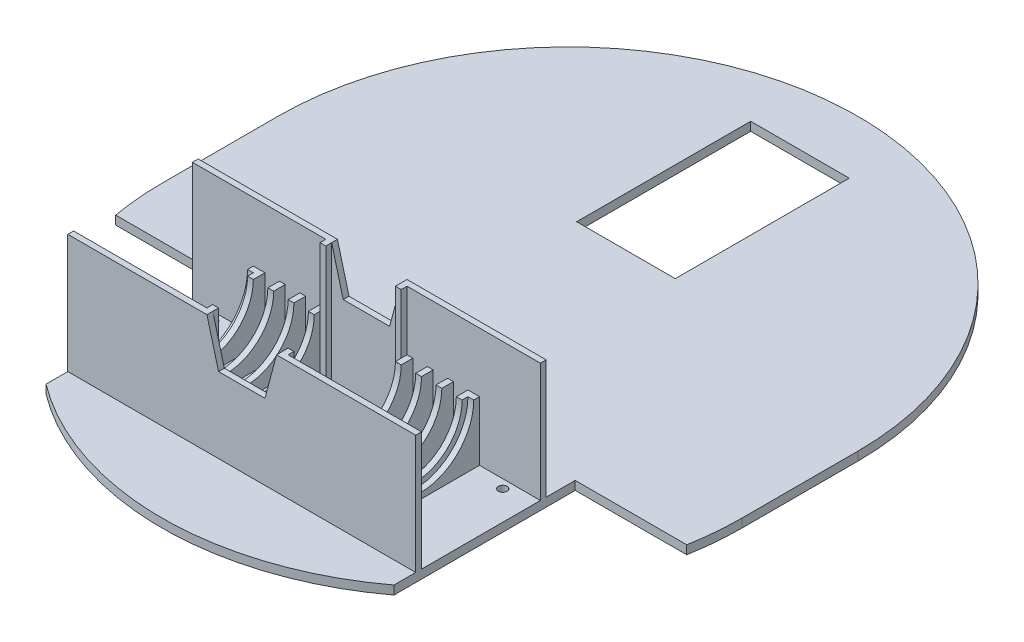
from build123d import *

# Parameters (mm, degrees)
EXTRUDE_1202_DEPTH     = 3
CUT_EXTRUDE_START      = -3
CUT_EXTRUDE_1565_DEPTH = 3
SKETCH_3_W             = 34
SKETCH_3_H             = 60
CUT_EXTRUDE_1805_DEPTH = 3
SKETCH_4_W             = 120
SKETCH_4_H             = 2
EXTRUDE_2279_DEPTH     = 41
SKETCH_5_W             = 4
SKETCH_5_H             = 41
SKETCH_5_W_2           = 2
EXTRUDE_3778_DEPTH     = 20.5
SKETCH_10_R            = 1.5
CUT_EXTRUDE_4209_DEPTH = 177.864354803
CUT_EXTRUDE_4433_DEPTH = 2
CUT_EXTRUDE_START_2    = -2
CUT_EXTRUDE_4648_DEPTH = 2
SKETCH_11_R            = 16.5
CUT_EXTRUDE_4763_DEPTH = 23
CUT_EXTRUDE_START_3    = -23
SKETCH_12_R            = 16.5
CUT_EXTRUDE_4892_DEPTH = 23
CUT_EXTRUDE_5120_DEPTH = 45
SKETCH_14_W            = 2
SKETCH_14_H            = 2
EXTRUDE_5971_DEPTH     = 41


with BuildPart() as part:
    # 草图1 → Extrude 1202 (new body)
    with BuildSketch(Plane(origin=(0, 0, 0), x_dir=(1, 0, 0), z_dir=(0, 1, 0))):
        with BuildLine():
            Line((-100, 40), (-100, 0))
            ThreePointArc((-100, 0), (0, -100), (100, 0))
            Line((100, 0), (100, 40))
            ThreePointArc((100, 40), (0, 140), (-100, 40))
        make_face()
    extrude(amount=EXTRUDE_1202_DEPTH)

    # 草图2 → Cut-Extrude 1565 (cut)
    with BuildSketch(Plane(origin=(0, 3, 0), x_dir=(1, 0, 0), z_dir=(0, 1, 0)).offset(CUT_EXTRUDE_START)):
        with BuildLine():
            Line((98.456843338, -17.5), (60, -17.5))
            Line((60, -17.5), (60, -80))
            ThreePointArc((60, -80), (85.168687322, -52.40510185), (98.456843338, -17.5))
        make_face()
        with BuildLine():
            ThreePointArc((-98.456843338, -17.5), (-85.168687322, -52.40510185), (-60, -80))
            Line((-60, -80), (-60, -17.5))
            Line((-60, -17.5), (-98.456843338, -17.5))
        make_face()
    extrude(amount=CUT_EXTRUDE_1565_DEPTH, mode=Mode.SUBTRACT)

    # 草图3 → Cut-Extrude 1805 (cut)
    with BuildSketch(Plane(origin=(0, 3, 0), x_dir=(1, 0, 0), z_dir=(0, 1, 0))):
        with Locations((0, 90)):
            Rectangle(SKETCH_3_W, SKETCH_3_H)
    extrude(amount=-CUT_EXTRUDE_1805_DEPTH, mode=Mode.SUBTRACT)

    # 草图4 → Extrude 2279 (add)
    with BuildSketch(Plane(origin=(0, 3, 0), x_dir=(1, 0, 0), z_dir=(0, 1, 0))):
        with Locations((0, -28.5)):
            Rectangle(SKETCH_4_W, SKETCH_4_H)
        with Locations((0, -71.5)):
            Rectangle(SKETCH_4_W, SKETCH_4_H)
    extrude(amount=EXTRUDE_2279_DEPTH)

    # 草图5 → Extrude 3778 (add)
    with BuildSketch(Plane(origin=(0, 3, 0), x_dir=(1, 0, 0), z_dir=(0, 1, 0))):
        with Locations((-37, -50)):
            Rectangle(SKETCH_5_W, SKETCH_5_H)
        with Locations((-29, -50)):
            Rectangle(SKETCH_5_W_2, SKETCH_5_H)
        with Locations((-22, -50)):
            Rectangle(SKETCH_5_W_2, SKETCH_5_H)
        with Locations((-15, -50)):
            Rectangle(SKETCH_5_W_2, SKETCH_5_H)
        with Locations((15, -50)):
            Rectangle(SKETCH_5_W_2, SKETCH_5_H)
        with Locations((22, -50)):
            Rectangle(SKETCH_5_W_2, SKETCH_5_H)
        with Locations((29, -50)):
            Rectangle(SKETCH_5_W_2, SKETCH_5_H)
        with Locations((37, -50)):
            Rectangle(SKETCH_5_W, SKETCH_5_H)
    extrude(amount=EXTRUDE_3778_DEPTH)

    # 草图10 → Cut-Extrude 4209 (cut, through all)
    with BuildSketch(Plane(origin=(0, 3, 0), x_dir=(1, 0, 0), z_dir=(0, 1, 0))):
        with Locations((-50, -32.5)):
            Circle(SKETCH_10_R)
        with Locations((-50, -67.5)):
            Circle(SKETCH_10_R)
        with Locations((50, -67.5)):
            Circle(SKETCH_10_R)
        with Locations((50, -32.5)):
            Circle(SKETCH_10_R)
    extrude(amount=-CUT_EXTRUDE_4209_DEPTH, mode=Mode.SUBTRACT)

    # 草图6 → Cut-Extrude 4433 (cut)
    with BuildSketch(Plane.ZY.offset(39)):
        with BuildLine():
            ThreePointArc((31.5, 23.5), (50, 5), (68.5, 23.5))
            Line((68.5, 23.5), (31.5, 23.5))
        make_face()
    extrude(amount=-CUT_EXTRUDE_4433_DEPTH, mode=Mode.SUBTRACT)

    # 草图8 → Cut-Extrude 4648 (cut)
    with BuildSketch(Plane(origin=(39, 0, 0), x_dir=(0, 0, -1), z_dir=(1, 0, 0)).offset(CUT_EXTRUDE_START_2)):
        with BuildLine():
            ThreePointArc((-68.5, 23.5), (-50, 5), (-31.5, 23.5))
            Line((-31.5, 23.5), (-68.5, 23.5))
        make_face()
    extrude(amount=CUT_EXTRUDE_4648_DEPTH, mode=Mode.SUBTRACT)

    # 草图11 → Cut-Extrude 4763 (cut)
    with BuildSketch(Plane.ZY.offset(37)):
        with Locations((50, 23.5)):
            Circle(SKETCH_11_R)
    extrude(amount=-CUT_EXTRUDE_4763_DEPTH, mode=Mode.SUBTRACT)

    # 草图12 → Cut-Extrude 4892 (cut)
    with BuildSketch(Plane(origin=(37, 0, 0), x_dir=(0, 0, -1), z_dir=(1, 0, 0)).offset(CUT_EXTRUDE_START_3)):
        with Locations((-50, 23.5)):
            Circle(SKETCH_12_R)
    extrude(amount=CUT_EXTRUDE_4892_DEPTH, mode=Mode.SUBTRACT)

    # 草图13 → Cut-Extrude 5120 (cut)
    with BuildSketch(Plane.XY.offset(72.5)):
        Polygon((-8, 29), (8, 29), (12, 44), (-12, 44), align=None)
    extrude(amount=-CUT_EXTRUDE_5120_DEPTH, mode=Mode.SUBTRACT)

    # 草图14 → Extrude 5971 (add)
    with BuildSketch(Plane(origin=(0, 3, 0), x_dir=(1, 0, 0), z_dir=(0, 1, 0))):
        with Locations((-13, -30.5)):
            Rectangle(SKETCH_14_W, SKETCH_14_H)
        with Locations((13, -30.5)):
            Rectangle(SKETCH_14_W, SKETCH_14_H)
        with Locations((-13, -69.5)):
            Rectangle(SKETCH_14_W, SKETCH_14_H)
        with Locations((13, -69.5)):
            Rectangle(SKETCH_14_W, SKETCH_14_H)
    extrude(amount=EXTRUDE_5971_DEPTH)


solid = part.part
